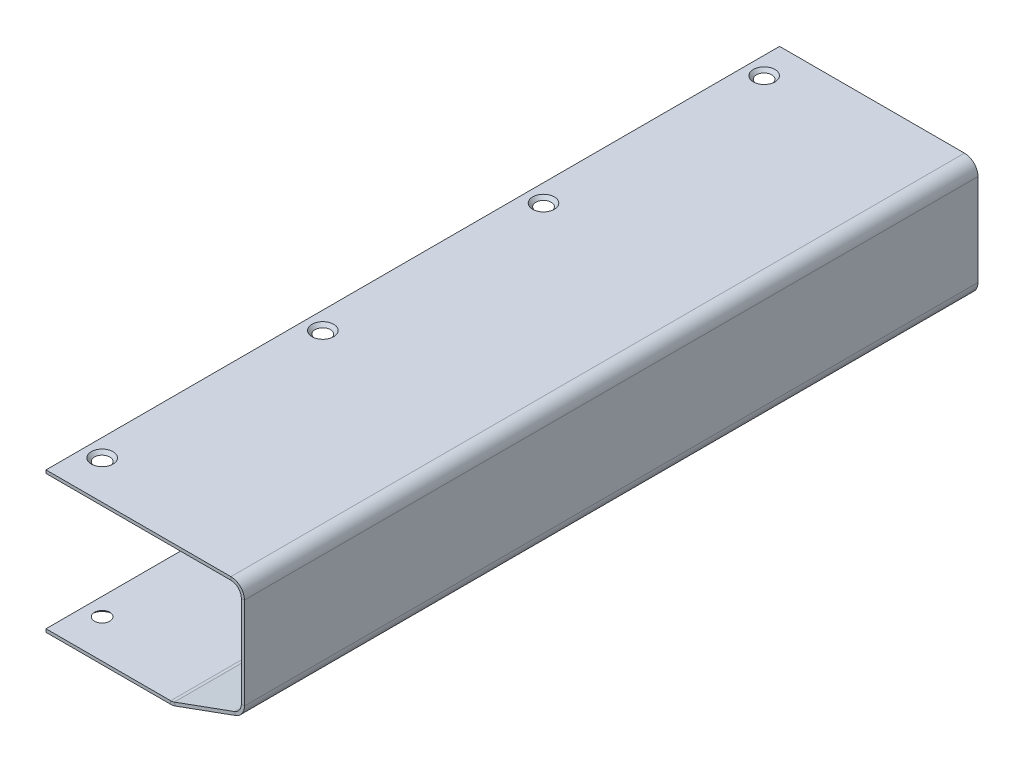
from build123d import *

# Parameters (mm, degrees)
CROQUIS2_W                                           = 95.38
CROQUIS2_H                                           = 352.6
BRIDA_BASE1_DEPTH                                    = 1.5
BRIDA_DE_ARISTA1_STRIP_W                             = 16
BRIDA_DE_ARISTA1_STRIP_H                             = 1.5
BRIDA_DE_ARISTA1_STRIP_CUT_DEPTH                     = 352.6
BRIDA_DE_ARISTA1_DEPTH                               = 352.6
BRIDA_START                                          = -176.3
BRIDA_DE_ARISTA2_DEPTH                               = 352.6
BRIDA_DE_ARISTA2_2_DEPTH                             = 352.6
BRIDA_DE_ARISTA3_DEPTH                               = 352.6
BRIDA_DE_ARISTA3_2_DEPTH                             = 352.6
CROQUIS22_R                                          = 2.25
CORTAR_EXTRUIR4_DEPTH                                = 312.548097
AVELLANADO_PARA_TORNILLO_CON_CABEZA_PLAN_D           = 5.5
AVELLANADO_PARA_TORNILLO_CON_CABEZA_PLAN_CSINK_D     = 10.4
AVELLANADO_PARA_TORNILLO_CON_CABEZA_PLAN_CSINK_ANGLE = 90
AVELLANADO_PARA_TORNILLO_CON_CABEZA_2_D              = 5.5
AVELLANADO_PARA_TORNILLO_CON_CABEZA_2_CSINK_D        = 10.4
AVELLANADO_PARA_TORNILLO_CON_CABEZA_2_CSINK_ANGLE    = 90


# Read off the part's stored shape, not the designer's step: Brida de arista2, Brida de arista3
# Sheet-metal steps are written as plain solids
with BuildPart() as part:
    # Croquis2 → Brida base1 (new body)
    with BuildSketch(Plane(origin=(0, 0, 0), x_dir=(1, 0, 0), z_dir=(0, 1, 0))):
        with Locations((-200.113558854, 0)):
            Rectangle(CROQUIS2_W, CROQUIS2_H)
    extrude(amount=-BRIDA_BASE1_DEPTH)

    # Brida de arista1 strip (across the edge) → Brida de arista1 strip cut (cut)
    with BuildSketch(Plane(origin=(-152.423558854, -1.5, -176.3), x_dir=(-1, 0, 0), z_dir=(0, 0, 1))):
        with Locations((-1.5, -0.75)):
            Rectangle(BRIDA_DE_ARISTA1_STRIP_W, BRIDA_DE_ARISTA1_STRIP_H)
    extrude(amount=BRIDA_DE_ARISTA1_STRIP_CUT_DEPTH, mode=Mode.SUBTRACT)

    # Brida de arista1 section (across the edge) → Brida de arista1 (add)
    with BuildSketch(Plane(origin=(-152.423558854, -1.5, -176.3), x_dir=(-1, 0, 0), z_dir=(0, 0, 1))):
        with BuildLine():
            Line((0, 5), (0, 54.19))
            Line((0, 54.19), (1.5, 54.19))
            Line((1.5, 54.19), (1.5, 5))
            ThreePointArc((1.5, 5), (2.964466094, 1.464466094), (6.5, 0))
            Line((6.5, 0), (6.5, -1.5))
            ThreePointArc((6.5, -1.5), (1.903805922, 0.403805922), (0, 5))
        make_face()
    extrude(amount=BRIDA_DE_ARISTA1_DEPTH)

    # Brida de arista2 outline → Brida de arista2 (cut)
    with BuildSketch(Plane.XY.offset(BRIDA_START)):
        with BuildLine():
            ThreePointArc((-152.423558854, -50.59269565), (-152.810049223, -52.800635867), (-153.923558854, -54.746007582))
            Line((-153.923558854, -54.746007582), (-153.923558854, -55.69))
            Line((-153.923558854, -55.69), (-152.423558854, -55.69))
            Line((-152.423558854, -55.69), (-152.423558854, -50.59269565))
        make_face()
    extrude(amount=BRIDA_DE_ARISTA2_DEPTH, mode=Mode.SUBTRACT)

    # Brida de arista2 2 outline → Brida de arista2 2 (add)
    with BuildSketch(Plane.XY.offset(BRIDA_START)):
        with BuildLine():
            Line((-190.603270036, -69.040323072), (-156.700427922, -56.700697685))
            ThreePointArc((-156.700427922, -56.700697685), (-155.182087424, -55.90789946), (-153.923558854, -54.746007582))
            Line((-153.923558854, -54.746007582), (-153.923558854, -50.59269565))
            ThreePointArc((-153.923558854, -50.59269565), (-154.827798632, -53.460577832), (-157.213458137, -55.291158754))
            Line((-157.213458137, -55.291158754), (-191.116300251, -67.630784141))
            Line((-191.116300251, -67.630784141), (-190.603270036, -69.040323072))
        make_face()
    extrude(amount=BRIDA_DE_ARISTA2_2_DEPTH)

    # Brida de arista3 outline → Brida de arista3 (cut)
    with BuildSketch(Plane.XY.offset(BRIDA_START)):
        with BuildLine():
            Line((-187.876719026, -67.630784141), (-191.116300251, -67.630784141))
            Line((-191.116300251, -67.630784141), (-190.603270036, -69.040323072))
            Line((-190.603270036, -69.040323072), (-185.653588094, -67.238786176))
            ThreePointArc((-185.653588094, -67.238786176), (-186.748005871, -67.532034535), (-187.876719026, -67.630784141))
        make_face()
    extrude(amount=BRIDA_DE_ARISTA3_DEPTH, mode=Mode.SUBTRACT)

    # Brida de arista3 2 outline → Brida de arista3 2 (add)
    with BuildSketch(Plane.XY.offset(BRIDA_START)):
        with BuildLine():
            Line((-247.803558854, -66.130784141), (-247.803558854, -67.630784141))
            Line((-247.803558854, -67.630784141), (-191.116300251, -67.630784141))
            Line((-191.116300251, -67.630784141), (-186.166618309, -65.829247245))
            ThreePointArc((-186.166618309, -65.829247245), (-187.008478137, -66.054822906), (-187.876719026, -66.130784141))
            Line((-187.876719026, -66.130784141), (-247.803558854, -66.130784141))
        make_face()
    extrude(amount=BRIDA_DE_ARISTA3_2_DEPTH)

    # Croquis22 → Cortar-Extruir4 (cut, through all)
    with BuildSketch(Plane.XZ):
        with Locations(Location((-239.303558854, 157.8, 0), (0, 0, 180))):
            Circle(CROQUIS22_R)
        with Locations(Location((-239.303558854, 51.733333333, 0), (0, 0, 180))):
            Circle(CROQUIS22_R)
        with Locations(Location((-239.303558854, -54.333333333, 0), (0, 0, 180))):
            Circle(CROQUIS22_R)
        with Locations(Location((-239.303558854, -160.4, 0), (0, 0, 180))):
            Circle(CROQUIS22_R)
    extrude(amount=CORTAR_EXTRUIR4_DEPTH, mode=Mode.SUBTRACT)

    # Avellanado para tornillo con cabeza plan (through all)
    with Locations(Plane(origin=(0, 0, 0), x_dir=(1, 0, 0), z_dir=(0, 1, 0))):
        with Locations((-239.303558854, 160.4), (-239.303558854, 54.333333333), (-239.303558854, -51.733333333), (-239.303558854, -157.8)):
            CounterSinkHole(AVELLANADO_PARA_TORNILLO_CON_CABEZA_PLAN_D / 2, AVELLANADO_PARA_TORNILLO_CON_CABEZA_PLAN_CSINK_D / 2, counter_sink_angle=AVELLANADO_PARA_TORNILLO_CON_CABEZA_PLAN_CSINK_ANGLE)

    # Avellanado para tornillo con cabeza  2 (through all)
    with Locations(Plane(origin=(0, -67.630784141, 0), x_dir=(-1, 0, 0), z_dir=(0, -1, 0))):
        with Locations((239.303558854, 160.4), (239.303558854, 54.333333333), (239.303558854, -51.733333333), (239.303558854, -157.8)):
            CounterSinkHole(AVELLANADO_PARA_TORNILLO_CON_CABEZA_2_D / 2, AVELLANADO_PARA_TORNILLO_CON_CABEZA_2_CSINK_D / 2, counter_sink_angle=AVELLANADO_PARA_TORNILLO_CON_CABEZA_2_CSINK_ANGLE)


solid = part.part
